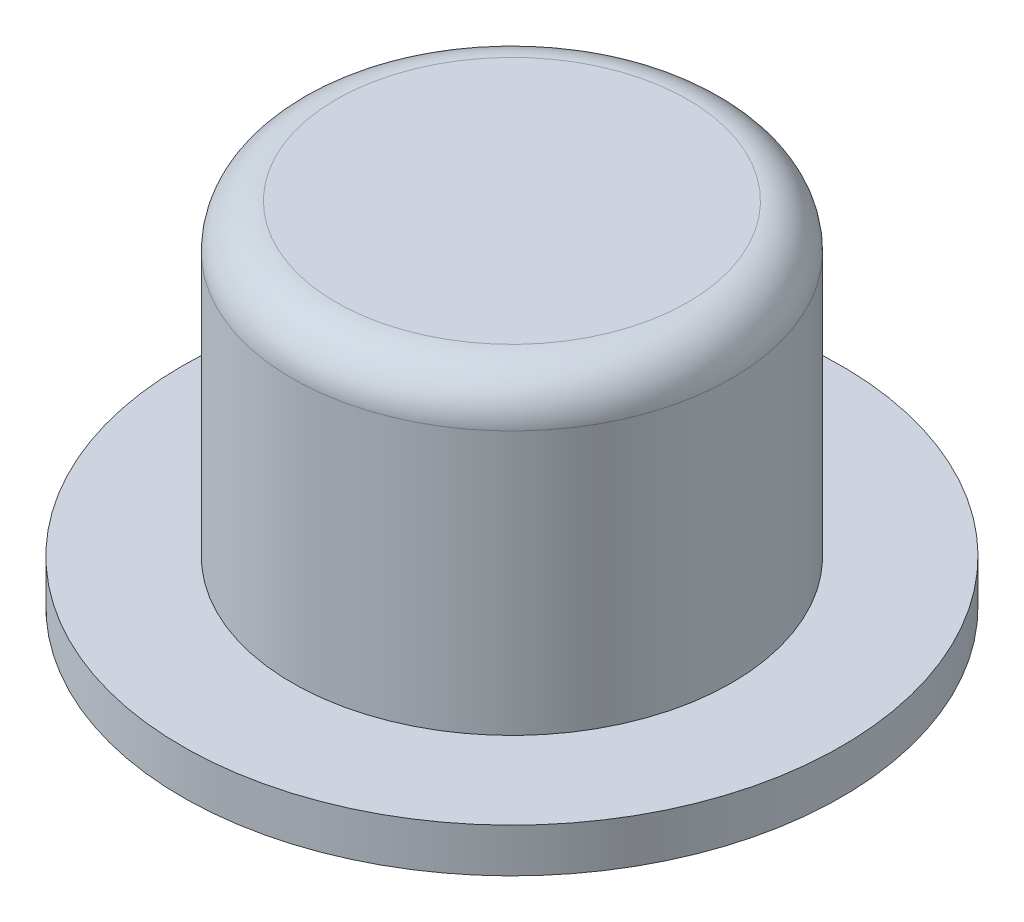
from build123d import *

# Parameters (mm, degrees)
SKETCH2_W          = 2.5
SKETCH2_H          = 3.5
CUT_EXTRUDE1_DEPTH = 3.5
FILLET1_R          = 1


with BuildPart() as part:
    # Sketch1 → Revolve1 (revolve)
    with BuildSketch(Plane.XY):
        Polygon((0, 8), (5, 8), (5, 1), (7.5, 1), (7.5, 0), (0, 0), align=None)
    revolve(axis=Axis((0, 8, 0), (0, -1, 0)))

    # Sketch2 → Cut-Extrude1 (cut)
    with BuildSketch(Plane.XZ):
        Rectangle(SKETCH2_W, SKETCH2_H)
    extrude(amount=-CUT_EXTRUDE1_DEPTH, mode=Mode.SUBTRACT)

    # Fillet1
    fillet1_edges = [part.edges().sort_by_distance(p)[0] for p in [
        (-5, 8, 0),
    ]]
    fillet(fillet1_edges, radius=FILLET1_R)


solid = part.part
